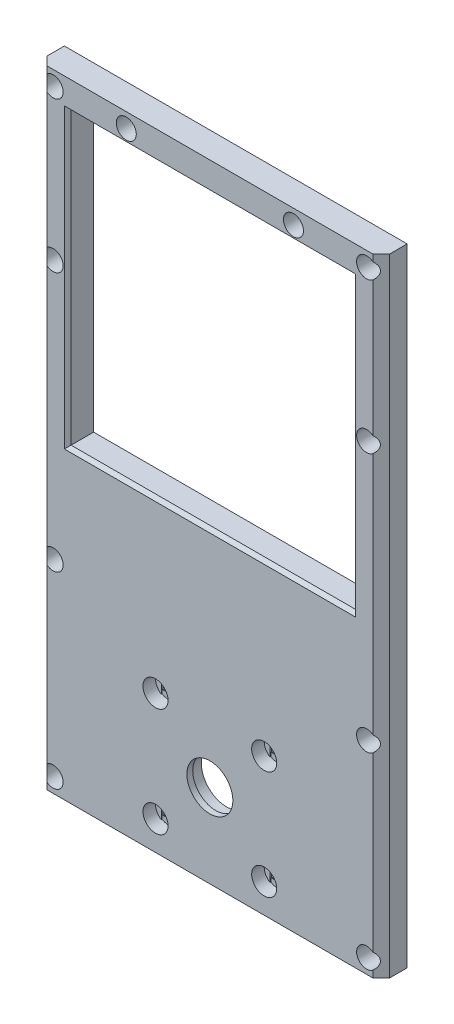
from build123d import *

# Parameters (mm, degrees)
SKETCH1_W           = 82
SKETCH1_H           = 150
SKETCH1_W_2         = 68
SKETCH1_H_2         = 136
BOSS_EXTRUDE1_DEPTH = 7
SKETCH2_W           = 68
SKETCH2_H           = 36
BOSS_EXTRUDE2_DEPTH = 7
SKETCH3_R           = 5.5
CUT_EXTRUDE1_DEPTH  = 86.761296632
SKETCH4_R           = 6.05
CUT_EXTRUDE2_DEPTH  = 5.6
SKETCH5_R           = 11
CUT_EXTRUDE3_DEPTH  = 3
SKETCH6_R           = 1.6
CUT_EXTRUDE4_DEPTH  = 86.761296632
SKETCH7_W           = 50
SKETCH7_H           = 38
CUT_EXTRUDE5_DEPTH  = 1
SKETCH8_R           = 3
CUT_EXTRUDE6_DEPTH  = 3
SKETCH9_R           = 1.35
CUT_EXTRUDE7_DEPTH  = 86.761296632
SKETCH10_R          = 2.4
CUT_EXTRUDE8_DEPTH  = 5
CHAMFER1_SIZE       = 2
SKETCH11_W          = 68
SKETCH11_H          = 30.5
BOSS_EXTRUDE3_DEPTH = 7
SKETCH12_R          = 1.35
CUT_EXTRUDE9_DEPTH  = 86.761296632
SKETCH13_R          = 2.4
CUT_EXTRUDE10_DEPTH = 5
CHAMFER2_SIZE       = 0.8
CUT_EXTRUDE11_DEPTH = 0.2
SKETCH15_W          = 2.7
SKETCH15_H          = 2.7
CUT_EXTRUDE12_DEPTH = 0.2
CUT_EXTRUDE13_DEPTH = 0.2
SKETCH17_W          = 3.2
SKETCH17_H          = 3.2
CUT_EXTRUDE14_DEPTH = 0.2


with BuildPart() as part:
    # Sketch1 → Boss-Extrude1 (new body)
    with BuildSketch(Plane.XY):
        Rectangle(SKETCH1_W, SKETCH1_H)
        Rectangle(SKETCH1_W_2, SKETCH1_H_2, mode=Mode.SUBTRACT)
    extrude(amount=BOSS_EXTRUDE1_DEPTH)

    # Sketch2 → Boss-Extrude2 (add)
    with BuildSketch(Plane.XY.offset(7)):
        with Locations((0, -50)):
            Rectangle(SKETCH2_W, SKETCH2_H)
    extrude(amount=-BOSS_EXTRUDE2_DEPTH)

    # Sketch3 → Cut-Extrude1 (cut, through all)
    with BuildSketch(Plane(origin=(0, 0, 0), x_dir=(-1, 0, 0), z_dir=(0, 0, -1))):
        with Locations((0, -55)):
            Circle(SKETCH3_R)
    extrude(amount=-CUT_EXTRUDE1_DEPTH, mode=Mode.SUBTRACT)

    # Sketch4 → Cut-Extrude2 (cut)
    with BuildSketch(Plane(origin=(0, 0, 0), x_dir=(-1, 0, 0), z_dir=(0, 0, -1))):
        with Locations((0, -55)):
            Circle(SKETCH4_R)
    extrude(amount=-CUT_EXTRUDE2_DEPTH, mode=Mode.SUBTRACT)

    # Sketch5 → Cut-Extrude3 (cut)
    with BuildSketch(Plane(origin=(0, 0, 0), x_dir=(-1, 0, 0), z_dir=(0, 0, -1))):
        with Locations((0, -55)):
            Circle(SKETCH5_R)
    extrude(amount=-CUT_EXTRUDE3_DEPTH, mode=Mode.SUBTRACT)

    # Sketch6 → Cut-Extrude4 (cut, through all)
    with BuildSketch(Plane(origin=(0, 0, 0), x_dir=(-1, 0, 0), z_dir=(0, 0, -1))):
        with Locations((-13, -42)):
            Circle(SKETCH6_R)
        with Locations((13, -42)):
            Circle(SKETCH6_R)
        with Locations((13, -68)):
            Circle(SKETCH6_R)
        with Locations((-13, -68)):
            Circle(SKETCH6_R)
    extrude(amount=-CUT_EXTRUDE4_DEPTH, mode=Mode.SUBTRACT)

    # Sketch7 → Cut-Extrude5 (cut)
    with BuildSketch(Plane(origin=(0, 0, 0), x_dir=(-1, 0, 0), z_dir=(0, 0, -1))):
        with Locations((0, -55)):
            Rectangle(SKETCH7_W, SKETCH7_H)
    extrude(amount=-CUT_EXTRUDE5_DEPTH, mode=Mode.SUBTRACT)

    # Sketch8 → Cut-Extrude6 (cut)
    with BuildSketch(Plane.XY.offset(7)):
        with Locations((-13, -42)):
            Circle(SKETCH8_R)
        with Locations((13, -42)):
            Circle(SKETCH8_R)
        with Locations((13, -68)):
            Circle(SKETCH8_R)
        with Locations((-13, -68)):
            Circle(SKETCH8_R)
    extrude(amount=-CUT_EXTRUDE6_DEPTH, mode=Mode.SUBTRACT)

    # Sketch9 → Cut-Extrude7 (cut, through all)
    with BuildSketch(Plane.XY.offset(7)):
        with Locations((-37.5, 71.5)):
            Circle(SKETCH9_R)
        with Locations((37.5, 71.5)):
            Circle(SKETCH9_R)
        with Locations((-37.5, -71.5)):
            Circle(SKETCH9_R)
        with Locations((37.5, -71.5)):
            Circle(SKETCH9_R)
        with Locations((-37.5, 35.5)):
            Circle(SKETCH9_R)
        with Locations((37.5, 35.5)):
            Circle(SKETCH9_R)
        with Locations((37.5, -26.5)):
            Circle(SKETCH9_R)
        with Locations((-37.5, -26.5)):
            Circle(SKETCH9_R)
    extrude(amount=-CUT_EXTRUDE7_DEPTH, mode=Mode.SUBTRACT)

    # Sketch10 → Cut-Extrude8 (cut)
    with BuildSketch(Plane.XY.offset(7)):
        with Locations((-37.5, 71.5)):
            Circle(SKETCH10_R)
        with Locations((37.5, 35.5)):
            Circle(SKETCH10_R)
        with Locations((-37.5, 35.5)):
            Circle(SKETCH10_R)
        with Locations((37.5, 71.5)):
            Circle(SKETCH10_R)
        with Locations((-37.5, -71.5)):
            Circle(SKETCH10_R)
        with Locations((37.5, -71.5)):
            Circle(SKETCH10_R)
        with Locations((-37.5, -26.5)):
            Circle(SKETCH10_R)
        with Locations((37.5, -26.5)):
            Circle(SKETCH10_R)
    extrude(amount=-CUT_EXTRUDE8_DEPTH, mode=Mode.SUBTRACT)

    # Chamfer1
    # the kernel refuses this chamfer: 2 mm, written as the material it takes off along each edge
    with BuildSketch(Plane(origin=(-41, 80.143365976, 7), x_dir=(-0.027495876610585623, 0, -0.9996219169112968), z_dir=(0, -1, 0)), Plane(origin=(41, -80.143365976, 7), x_dir=(0.027495876610585623, 0, -0.9996219169112968), z_dir=(0, 1, 0))) as chamfer1_piece_1:
        Polygon((CHAMFER1_SIZE * 0.999621916911, CHAMFER1_SIZE * 0.0274958766106), (-CHAMFER1_SIZE * 0.0274958766106, CHAMFER1_SIZE * 0.999621916911), (0, 0), align=None)
    extrude(amount=160.286731952, mode=Mode.SUBTRACT)

    # Sketch11 → Boss-Extrude3 (add)
    with BuildSketch(Plane.XY.offset(7)):
        with Locations((0, -16.75)):
            Rectangle(SKETCH11_W, SKETCH11_H)
    extrude(amount=-BOSS_EXTRUDE3_DEPTH)

    # Sketch12 → Cut-Extrude9 (cut, through all)
    with BuildSketch(Plane.XY.offset(7)):
        with Locations((-20, 71.5)):
            Circle(SKETCH12_R)
        with Locations((20, 71.5)):
            Circle(SKETCH12_R)
    extrude(amount=-CUT_EXTRUDE9_DEPTH, mode=Mode.SUBTRACT)

    # Sketch13 → Cut-Extrude10 (cut)
    with BuildSketch(Plane.XY.offset(7)):
        with Locations((-20, 71.5)):
            Circle(SKETCH13_R)
        with Locations((20, 71.5)):
            Circle(SKETCH13_R)
    extrude(amount=-CUT_EXTRUDE10_DEPTH, mode=Mode.SUBTRACT)

    # Chamfer2
    chamfer2_edges = [part.edges().sort_by_distance(p)[0] for p in [
        (0, 68, 0),
        (-34, 33.25, 0),
        (0, 68, 7),
        (-34, 33.25, 7),
        (34, 33.25, 7),
        (34, 33.25, 0),
        (0, -1.5, 7),
        (0, -1.5, 0),
        (0, -75, 0),
        (-41, 0, 0),
        (0, 75, 0),
        (41, 0, 0),
    ]]
    chamfer(chamfer2_edges, length=CHAMFER2_SIZE)

    # Sketch14 → Cut-Extrude11 (cut)
    with BuildSketch(Plane.XY.offset(2)):
        with BuildLine():
            Line((-38.85, -28.484313483), (-38.85, -24.515686517))
            ThreePointArc((-38.85, -24.515686517), (-37.5, -24.1), (-36.15, -24.515686517))
            Line((-36.15, -24.515686517), (-36.15, -28.484313483))
            ThreePointArc((-36.15, -28.484313483), (-37.5, -28.9), (-38.85, -28.484313483))
        make_face()
        with BuildLine():
            Line((-38.85, -73.484313483), (-38.85, -69.515686517))
            ThreePointArc((-38.85, -69.515686517), (-37.5, -69.1), (-36.15, -69.515686517))
            Line((-36.15, -69.515686517), (-36.15, -73.484313483))
            ThreePointArc((-36.15, -73.484313483), (-37.5, -73.9), (-38.85, -73.484313483))
        make_face()
        with BuildLine():
            Line((-38.85, 33.515686517), (-38.85, 37.484313483))
            ThreePointArc((-38.85, 37.484313483), (-37.5, 37.9), (-36.15, 37.484313483))
            Line((-36.15, 37.484313483), (-36.15, 33.515686517))
            ThreePointArc((-36.15, 33.515686517), (-37.5, 33.1), (-38.85, 33.515686517))
        make_face()
        with BuildLine():
            Line((-21.35, 69.515686517), (-21.35, 73.484313483))
            ThreePointArc((-21.35, 73.484313483), (-20, 73.9), (-18.65, 73.484313483))
            Line((-18.65, 73.484313483), (-18.65, 69.515686517))
            ThreePointArc((-18.65, 69.515686517), (-20, 69.1), (-21.35, 69.515686517))
        make_face()
        with BuildLine():
            Line((-38.85, 69.515686517), (-38.85, 73.484313483))
            ThreePointArc((-38.85, 73.484313483), (-37.5, 73.9), (-36.15, 73.484313483))
            Line((-36.15, 73.484313483), (-36.15, 69.515686517))
            ThreePointArc((-36.15, 69.515686517), (-37.5, 69.1), (-38.85, 69.515686517))
        make_face()
    cut_extrude11 = extrude(amount=-CUT_EXTRUDE11_DEPTH, mode=Mode.SUBTRACT)

    # Sketch15 → Cut-Extrude12 (cut)
    with BuildSketch(Plane.XY.offset(1.8)):
        with Locations((-37.5, -71.5)):
            Rectangle(SKETCH15_W, SKETCH15_H)
        with Locations((-37.5, -26.5)):
            Rectangle(SKETCH15_W, SKETCH15_H)
        with Locations((-37.5, 35.5)):
            Rectangle(SKETCH15_W, SKETCH15_H)
        with Locations((-37.5, 71.5)):
            Rectangle(SKETCH15_W, SKETCH15_H)
        with Locations((-20, 71.5)):
            Rectangle(SKETCH15_W, SKETCH15_H)
    cut_extrude12 = extrude(amount=-CUT_EXTRUDE12_DEPTH, mode=Mode.SUBTRACT)

    # Sketch16 → Cut-Extrude13 (cut)
    with BuildSketch(Plane.XY.offset(4)):
        with BuildLine():
            Line((-14.6, -44.537715508), (-14.6, -39.462284492))
            ThreePointArc((-14.6, -39.462284492), (-13, -39), (-11.4, -39.462284492))
            Line((-11.4, -39.462284492), (-11.4, -44.537715508))
            ThreePointArc((-11.4, -44.537715508), (-13, -45), (-14.6, -44.537715508))
        make_face()
        with BuildLine():
            Line((-14.6, -70.537715508), (-14.6, -65.462284492))
            ThreePointArc((-14.6, -65.462284492), (-13, -65), (-11.4, -65.462284492))
            Line((-11.4, -65.462284492), (-11.4, -70.537715508))
            ThreePointArc((-11.4, -70.537715508), (-13, -71), (-14.6, -70.537715508))
        make_face()
    cut_extrude13 = extrude(amount=-CUT_EXTRUDE13_DEPTH, mode=Mode.SUBTRACT)

    # Sketch17 → Cut-Extrude14 (cut)
    with BuildSketch(Plane.XY.offset(3.8)):
        with Locations((-13, -42)):
            Rectangle(SKETCH17_W, SKETCH17_H)
        with Locations((-13, -68)):
            Rectangle(SKETCH17_W, SKETCH17_H)
    cut_extrude14 = extrude(amount=-CUT_EXTRUDE14_DEPTH, mode=Mode.SUBTRACT)

    # Mirror1: Cut-Extrude11, Cut-Extrude12, Cut-Extrude13, Cut-Extrude14 across plane
    add(cut_extrude11.mirror(Plane(origin=(0, 0, 0), x_dir=(0, 0, 1), z_dir=(1, 0, 0))), mode=Mode.SUBTRACT)
    add(cut_extrude12.mirror(Plane(origin=(0, 0, 0), x_dir=(0, 0, 1), z_dir=(1, 0, 0))), mode=Mode.SUBTRACT)
    add(cut_extrude13.mirror(Plane(origin=(0, 0, 0), x_dir=(0, 0, 1), z_dir=(1, 0, 0))), mode=Mode.SUBTRACT)
    add(cut_extrude14.mirror(Plane(origin=(0, 0, 0), x_dir=(0, 0, 1), z_dir=(1, 0, 0))), mode=Mode.SUBTRACT)


solid = part.part
